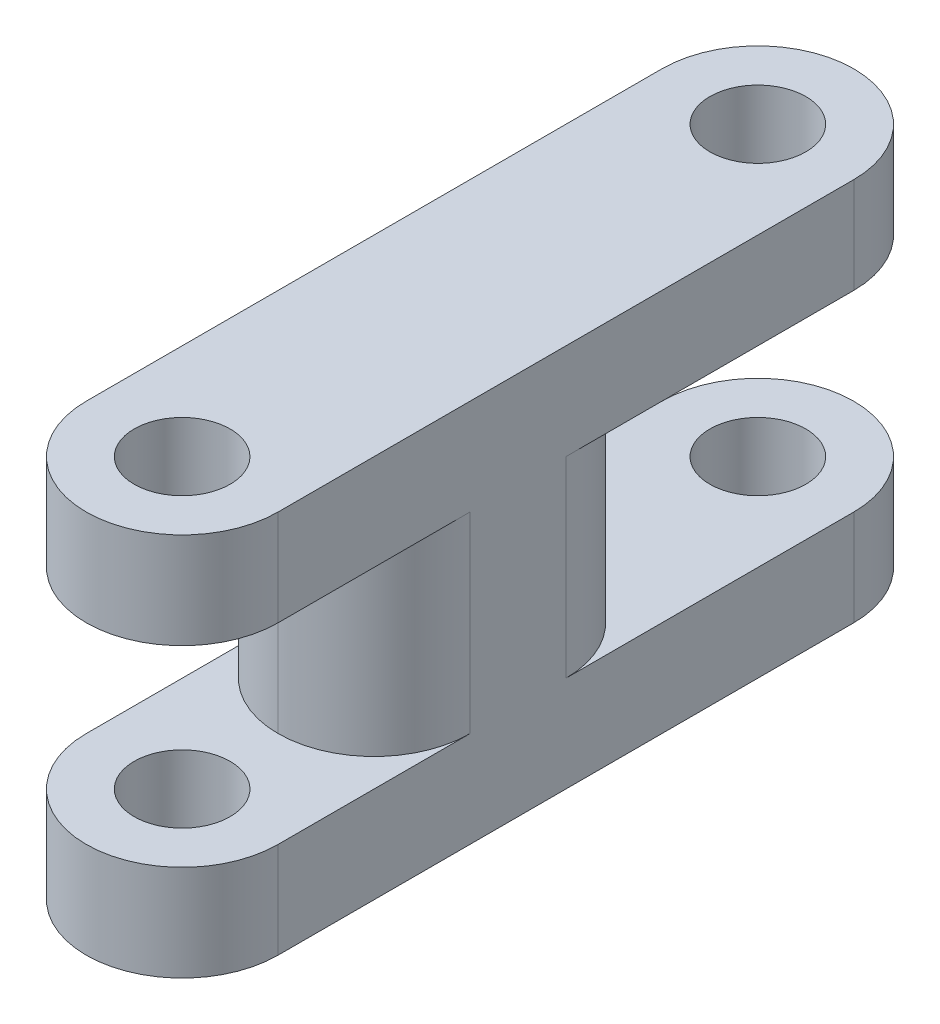
from build123d import *

# Parameters (mm, degrees)
SKETCH1_R           = 2.5
BOSS_EXTRUDE1_DEPTH = 20
SKETCH2_W           = 10
SKETCH2_H           = 10
CUT_EXTRUDE1_DEPTH  = 15
FILLET1_R           = 5
SKETCH3_W           = 10
SKETCH3_H           = 10
CUT_EXTRUDE3_DEPTH  = 10
FILLET3_R           = 5


with BuildPart() as part:
    # Sketch1 → Boss-Extrude1 (new body)
    with BuildSketch(Plane(origin=(0, 0, 0), x_dir=(1, 0, 0), z_dir=(0, 1, 0))):
        with BuildLine():
            Line((-5, 0), (-5, 30))
            ThreePointArc((-5, 30), (0, 35), (5, 30))
            Line((5, 30), (5, 0))
            ThreePointArc((5, 0), (0, -5), (-5, 0))
        make_face()
        with Locations(Location((0, 30, 0), (0, 0, 270))):
            Circle(SKETCH1_R, mode=Mode.SUBTRACT)
        with Locations(Location((0, 0, 0), (0, 0, 270))):
            Circle(SKETCH1_R, mode=Mode.SUBTRACT)
    extrude(amount=BOSS_EXTRUDE1_DEPTH)

    # Sketch2 → Cut-Extrude1 (cut)
    with BuildSketch(Plane(origin=(5, 0, 0), x_dir=(0, 0, -1), z_dir=(1, 0, 0))):
        with Locations((0, 10)):
            Rectangle(SKETCH2_W, SKETCH2_H)
    cut_extrude1 = extrude(amount=-CUT_EXTRUDE1_DEPTH, mode=Mode.SUBTRACT)

    # Mirror1: Cut-Extrude1 across plane
    add(cut_extrude1.mirror(Plane.XY.offset(-15)), mode=Mode.SUBTRACT)

    # Fillet1
    fillet1_edges = [part.edges().sort_by_distance(p)[0] for p in [
        (-5, 10, -25),
        (5, 10, -25),
        (-5, 10, -5),
        (5, 10, -5),
    ]]
    fillet(fillet1_edges, radius=FILLET1_R - 0.0001)  # a hair under: the kernel refuses the full size

    # Sketch3 → Cut-Extrude3 (cut)
    with BuildSketch(Plane(origin=(5, 0, 0), x_dir=(0, 0, -1), z_dir=(1, 0, 0))):
        with Locations((25, 10)):
            Rectangle(SKETCH3_W, SKETCH3_H)
    extrude(amount=-CUT_EXTRUDE3_DEPTH, mode=Mode.SUBTRACT)

    # Fillet3
    fillet3_edges = [part.edges().sort_by_distance(p)[0] for p in [
        (-5, 10, -20.0001),
        (5, 10, -20.0001),
    ]]
    fillet(fillet3_edges, radius=FILLET3_R - 0.0001)  # a hair under: the kernel refuses the full size


solid = part.part
